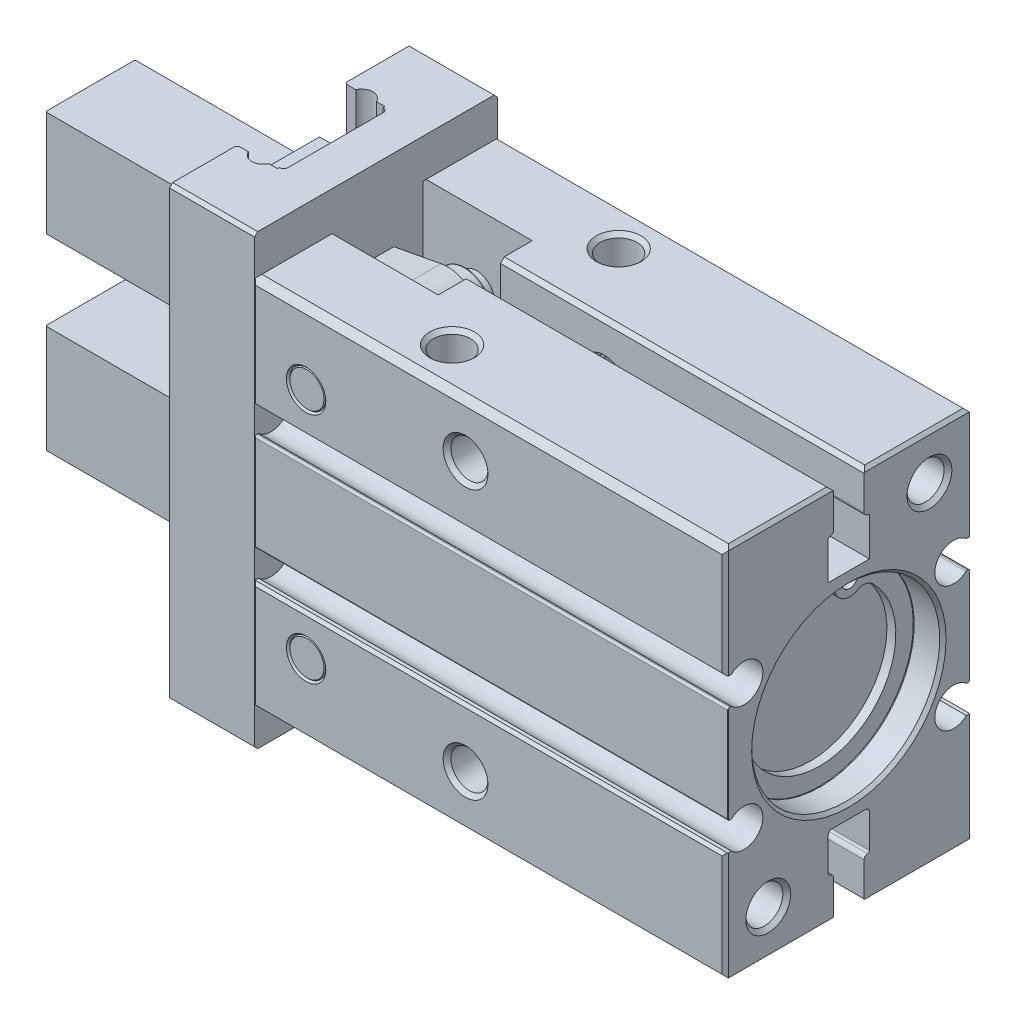
from build123d import *

# Parameters (mm, degrees)
EXTRUDE_1_DEPTH          = 52.8
CUT_EXTRUDE_1_DEPTH      = 21
CUT_EXTRUDE_1_DEPTH_BACK = 21
SKETCH_2_W               = 12.2
SKETCH_2_H               = 10.5
CUT_EXTRUDE_2_DEPTH      = 21
CUT_EXTRUDE_2_DEPTH_BACK = 21
SKETCH_5_W               = 54.8
SKETCH_5_H               = 29.6
CUT_EXTRUDE_3_DEPTH      = 13.8
CUT_EXTRUDE_3_DEPTH_BACK = 13.8
SKETCH_6_W               = 54.8
SKETCH_6_H               = 44
EXTRUDE_2_DEPTH          = 9.5
CUT_EXTRUDE_4_DEPTH      = 25
CUT_EXTRUDE_4_DEPTH_BACK = 25
EXTRUDE_3_DEPTH          = 19.4
EXTRUDE_4_DEPTH          = 19.4
EXTRUDE_5_DEPTH          = 8.399908734
EXTRUDE_5_DEPTH_BACK     = 3.365801971
EXTRUDE_6_DEPTH          = 12
EXTRUDE_6_DEPTH_BACK     = 0.0001
CUT_EXTRUDE_5_DEPTH      = 2.1
CUT_EXTRUDE_5_DEPTH_BACK = 2.1
SKETCH_20_W              = 7
SKETCH_20_H              = 9
EXTRUDE_7_DEPTH          = 2
EXTRUDE_7_DEPTH_BACK     = 2
SKETCH_26_R              = 1.65
SKETCH_26_R_2            = 1.5
CUT_EXTRUDE_6_DEPTH      = 0.2
CUT_EXTRUDE_7_DEPTH      = 0.5
SKETCH_28_R              = 1.65
SKETCH_28_R_2            = 1.5
EXTRUDE_8_DEPTH          = 0.2
CUT_EXTRUDE_8_DEPTH      = 0.5
CUT_EXTRUDE_START        = -0.2
SKETCH_30_R              = 1.65
SKETCH_30_R_2            = 1.5
CUT_EXTRUDE_9_DEPTH      = 0.2
CUT_EXTRUDE_10_DEPTH     = 0.5
SKETCH_32_R              = 1.65
SKETCH_32_R_2            = 1.5
CUT_EXTRUDE_11_DEPTH     = 0.2
CUT_EXTRUDE_12_DEPTH     = 0.5
EXTRUDE_START            = 1
SKETCH_39_R              = 0.9
EXTRUDE_9_DEPTH          = 1


with BuildPart() as part:
    # 草图1 → 凸台-拉伸1 (new body)
    with BuildSketch(Plane(origin=(0, 0, 0), x_dir=(0, 0, -1), z_dir=(1, 0, 0))):
        with BuildLine():
            Line((-13.8, 20.292893219), (-13.8, 8.85))
            Line((-13.8, 8.85), (-13.5, 8.55))
            Line((-13.5, 8.55), (-13.116862732, 8.55))
            ThreePointArc((-13.116862732, 8.55), (-9.600310792, 7.036127953), (-13.062700186, 5.402173913))
            ThreePointArc((-13.062700186, 5.402173913), (-13.123324748, 5.437662973), (-13.192481156, 5.45))
            Line((-13.192481156, 5.45), (-13.3, 5.45))
            ThreePointArc((-13.3, 5.45), (-13.441421356, 5.391421356), (-13.5, 5.25))
            Line((-13.5, 5.25), (-13.5, -5.25))
            ThreePointArc((-13.5, -5.25), (-13.441421356, -5.391421356), (-13.3, -5.45))
            Line((-13.3, -5.45), (-13.192481156, -5.45))
            ThreePointArc((-13.192481156, -5.45), (-13.123324748, -5.437662973), (-13.062700186, -5.402173913))
            ThreePointArc((-13.062700186, -5.402173913), (-9.600310792, -7.036127953), (-13.116862732, -8.55))
            Line((-13.116862732, -8.55), (-13.5, -8.55))
            Line((-13.5, -8.55), (-13.8, -8.85))
            Line((-13.8, -8.85), (-13.8, -20.292893219))
            Line((-13.8, -20.292893219), (-13.092893219, -21))
            Line((-13.092893219, -21), (-2.124264069, -21))
            Line((-2.124264069, -21), (-1.7, -20.575735931))
            Line((-1.7, -20.575735931), (-1.7, -16.8))
            ThreePointArc((-1.7, -16.8), (-1.817157296, -16.517157279), (-2.100000024, -16.4))
            ThreePointArc((-2.100000024, -16.4), (-2.241421365, -16.341421348), (-2.3, -16.2))
            Line((-2.3, -16.2), (-2.3, -12.4))
            ThreePointArc((-2.3, -12.4), (-2.182842712, -12.117157288), (-1.9, -12))
            Line((-1.9, -12), (1.9, -12))
            ThreePointArc((1.9, -12), (2.182842712, -12.117157288), (2.3, -12.4))
            Line((2.3, -12.4), (2.3, -16.2))
            ThreePointArc((2.3, -16.2), (2.241421348, -16.341421365), (2.099999976, -16.4))
            ThreePointArc((2.099999976, -16.4), (1.817157279, -16.517157296), (1.7, -16.8))
            Line((1.7, -16.8), (1.7, -20.575735931))
            Line((1.7, -20.575735931), (2.124264069, -21))
            Line((2.124264069, -21), (13.092893219, -21))
            Line((13.092893219, -21), (13.8, -20.292893219))
            Line((13.8, -20.292893219), (13.8, -8.85))
            Line((13.8, -8.85), (13.5, -8.55))
            Line((13.5, -8.55), (13.116862732, -8.55))
            ThreePointArc((13.116862732, -8.55), (9.600310792, -7.036127953), (13.062700186, -5.402173913))
            ThreePointArc((13.062700186, -5.402173913), (13.123324748, -5.437662973), (13.192481156, -5.45))
            Line((13.192481156, -5.45), (13.3, -5.45))
            ThreePointArc((13.3, -5.45), (13.441421356, -5.391421356), (13.5, -5.25))
            Line((13.5, -5.25), (13.5, 5.25))
            ThreePointArc((13.5, 5.25), (13.441421356, 5.391421356), (13.3, 5.45))
            Line((13.3, 5.45), (13.192481156, 5.45))
            ThreePointArc((13.192481156, 5.45), (13.123324748, 5.437662973), (13.062700186, 5.402173913))
            ThreePointArc((13.062700186, 5.402173913), (9.600310792, 7.036127953), (13.116862732, 8.55))
            Line((13.116862732, 8.55), (13.5, 8.55))
            Line((13.5, 8.55), (13.8, 8.85))
            Line((13.8, 8.85), (13.8, 20.292893219))
            Line((13.8, 20.292893219), (13.092893219, 21))
            Line((13.092893219, 21), (2.124264069, 21))
            Line((2.124264069, 21), (1.7, 20.575735931))
            Line((1.7, 20.575735931), (1.7, 16.8))
            ThreePointArc((1.7, 16.8), (1.817157279, 16.517157296), (2.099999976, 16.4))
            ThreePointArc((2.099999976, 16.4), (2.241421348, 16.341421365), (2.3, 16.2))
            Line((2.3, 16.2), (2.3, 12))
            Line((2.3, 12), (-2.3, 12))
            Line((-2.3, 12), (-2.3, 16.2))
            ThreePointArc((-2.3, 16.2), (-2.241421348, 16.341421365), (-2.099999976, 16.4))
            ThreePointArc((-2.099999976, 16.4), (-1.817157279, 16.517157296), (-1.7, 16.8))
            Line((-1.7, 16.8), (-1.7, 20.575735931))
            Line((-1.7, 20.575735931), (-2.124264069, 21))
            Line((-2.124264069, 21), (-13.092893219, 21))
            Line((-13.092893219, 21), (-13.8, 20.292893219))
        make_face()
    extrude(amount=-EXTRUDE_1_DEPTH)

    # 草图2 → 切除-拉伸1 (cut, two sides: drawn at the far end of the back side and taken through both)
    with BuildSketch(Plane(origin=(0, 0, 0), x_dir=(1, 0, 0), z_dir=(0, 1, 0)).offset(-CUT_EXTRUDE_1_DEPTH_BACK)):
        with Locations((-46.7, 0)):
            Rectangle(SKETCH_2_W, SKETCH_2_H)
    extrude(amount=CUT_EXTRUDE_1_DEPTH + CUT_EXTRUDE_1_DEPTH_BACK, mode=Mode.SUBTRACT)

    # 草图3 → 切除-旋转1 (revolve, cut)
    with BuildSketch(Plane(origin=(-29, 0, 0), x_dir=(0, 0, -1), z_dir=(1, 0, 0))):
        Polygon((-13.8, 15), (-13.8, 17.5), (-13.367, 17.067), (-3.8, 17.067), (-3.8, 17.51), (3.8, 17.51), (3.8, 17.067), (13.367, 17.067), (13.8, 17.5), (13.8, 15), align=None)
    revolve(axis=Axis((-29, 15, -13.8), (0, 0, 1)), mode=Mode.SUBTRACT)

    # 草图4 → 切除-旋转2 (revolve, cut)
    with BuildSketch(Plane(origin=(-29, 0, 0), x_dir=(0, 0, -1), z_dir=(1, 0, 0))):
        Polygon((-13.8, -15), (-13.8, -12.5), (-13.367, -12.933), (-3.8, -12.933), (-3.8, -12.49), (3.8, -12.49), (3.8, -12.933), (13.367, -12.933), (13.8, -12.5), (13.8, -15), align=None)
    revolve(axis=Axis((-29, -15, -13.8), (0, 0, 1)), mode=Mode.SUBTRACT)

    # 草图5 → 切除-拉伸2 (cut, two sides: drawn at the far end of the back side and taken through both)
    with BuildSketch(Plane(origin=(0, 0, 0), x_dir=(1, 0, 0), z_dir=(0, 1, 0)).offset(-CUT_EXTRUDE_2_DEPTH_BACK)):
        with Locations((-26.4, 0)):
            Rectangle(SKETCH_5_W, SKETCH_5_H)
        Polygon((-52.8, 13.446446609), (-52.8, -13.446446609), (-52.446446609, -13.8), (-0.353553391, -13.8), (0, -13.446446609), (0, 13.446446609), (-0.353553391, 13.8), (-52.446446609, 13.8), align=None, mode=Mode.SUBTRACT)
    extrude(amount=CUT_EXTRUDE_2_DEPTH + CUT_EXTRUDE_2_DEPTH_BACK, mode=Mode.SUBTRACT)

    # 草图6 → 切除-拉伸3 (cut, two sides: drawn at the far end of the back side and taken through both)
    with BuildSketch(Plane.XY.offset(-CUT_EXTRUDE_3_DEPTH_BACK)):
        with Locations((-26.4, 0)):
            Rectangle(SKETCH_6_W, SKETCH_6_H)
        Polygon((-52.8, -20.646446609), (-52.446446609, -21), (-0.353553391, -21), (0, -20.646446609), (0, 20.646446609), (-0.353553391, 21), (-52.446446609, 21), (-52.8, 20.646446609), align=None, mode=Mode.SUBTRACT)
    extrude(amount=CUT_EXTRUDE_3_DEPTH + CUT_EXTRUDE_3_DEPTH_BACK, mode=Mode.SUBTRACT)

    # 草图7 → 凸台-拉伸2 (add)
    with BuildSketch(Plane(origin=(-52.8, 0, 0), x_dir=(0, 0, -1), z_dir=(1, 0, 0))):
        Polygon((-13.55, -24.646446609), (-13.196446609, -25), (13.196446609, -25), (13.55, -24.646446609), (13.55, 24.646446609), (13.196446609, 25), (-13.196446609, 25), (-13.55, 24.646446609), align=None)
    extrude(amount=-EXTRUDE_2_DEPTH)

    # 草图8 → 切除-拉伸4 (cut, two sides: drawn at the far end of the back side and taken through both)
    with BuildSketch(Plane(origin=(0, 0, 0), x_dir=(1, 0, 0), z_dir=(0, 1, 0)).offset(-CUT_EXTRUDE_4_DEPTH_BACK)):
        with BuildLine():
            Line((-62.3, -6.212132034), (-62.087867966, -6))
            Line((-62.087867966, -6), (-61.045643924, -6))
            ThreePointArc((-61.045643924, -6), (-59.9, -6.75), (-58.754356076, -6))
            Line((-58.754356076, -6), (-57.8, -6))
            Line((-57.8, -6), (-57.8, -5.8))
            ThreePointArc((-57.8, -5.8), (-57.446446609, -5.653553391), (-57.3, -5.3))
            Line((-57.3, -5.3), (-57.3, 5.3))
            ThreePointArc((-57.3, 5.3), (-57.446446609, 5.653553391), (-57.8, 5.8))
            Line((-57.8, 5.8), (-57.8, 6))
            Line((-57.8, 6), (-58.754356076, 6))
            ThreePointArc((-58.754356076, 6), (-59.9, 6.75), (-61.045643924, 6))
            Line((-61.045643924, 6), (-62.087867966, 6))
            Line((-62.087867966, 6), (-62.3, 6.212132034))
            Line((-62.3, 6.212132034), (-62.3, -6.212132034))
        make_face()
    extrude(amount=CUT_EXTRUDE_4_DEPTH + CUT_EXTRUDE_4_DEPTH_BACK, mode=Mode.SUBTRACT)

    # 草图9 → 凸台-拉伸3 (add)
    with BuildSketch(Plane(origin=(0, 0.01, 0), x_dir=(1, 0, 0), z_dir=(0, 1, 0))):
        with BuildLine():
            Line((-64.1, -5), (-61.81, -5))
            Line((-61.81, -5), (-61.113631045, -6.200667934))
            ThreePointArc((-61.113631045, -6.200667934), (-59.9, -7.75), (-58.686368955, -6.200667934))
            Line((-58.686368955, -6.200667934), (-57.99, -5))
            Line((-57.99, -5), (-57.641421356, -5))
            Line((-57.641421356, -5), (-57.5, -4.858578644))
            Line((-57.5, -4.858578644), (-57.5, 4.858578644))
            Line((-57.5, 4.858578644), (-57.641421356, 5))
            Line((-57.641421356, 5), (-57.99, 5))
            Line((-57.99, 5), (-58.686368955, 6.200667934))
            ThreePointArc((-58.686368955, 6.200667934), (-59.9, 7.75), (-61.113631045, 6.200667934))
            Line((-61.113631045, 6.200667934), (-61.81, 5))
            Line((-61.81, 5), (-64.1, 5))
            Line((-64.1, 5), (-64.1, -5))
        make_face()
    extrude(amount=EXTRUDE_3_DEPTH)

    # 草图10 → 凸台-拉伸4 (add)
    with BuildSketch(Plane(origin=(0, -0.01, 0), x_dir=(1, 0, 0), z_dir=(0, 1, 0))):
        with BuildLine():
            Line((-64.1, -5), (-61.81, -5))
            Line((-61.81, -5), (-61.113631045, -6.200667934))
            ThreePointArc((-61.113631045, -6.200667934), (-59.9, -7.75), (-58.686368955, -6.200667934))
            Line((-58.686368955, -6.200667934), (-57.99, -5))
            Line((-57.99, -5), (-57.641421356, -5))
            Line((-57.641421356, -5), (-57.5, -4.858578644))
            Line((-57.5, -4.858578644), (-57.5, 4.858578644))
            Line((-57.5, 4.858578644), (-57.641421356, 5))
            Line((-57.641421356, 5), (-57.99, 5))
            Line((-57.99, 5), (-58.686368955, 6.200667934))
            ThreePointArc((-58.686368955, 6.200667934), (-59.9, 7.75), (-61.113631045, 6.200667934))
            Line((-61.113631045, 6.200667934), (-61.81, 5))
            Line((-61.81, 5), (-64.1, 5))
            Line((-64.1, 5), (-64.1, -5))
        make_face()
    extrude(amount=-EXTRUDE_4_DEPTH)

    # 草图11 → 凸台-拉伸5 (add, two sides: drawn at the far end of the back side and taken through both)
    with BuildSketch(Plane(origin=(0, 8.15, 0), x_dir=(1, 0, 0), z_dir=(0, 1, 0)).offset(-EXTRUDE_5_DEPTH_BACK)):
        Polygon((-84.7, -4.858578644), (-84.558578644, -5), (-64.1, -5), (-64.1, 5), (-84.558578644, 5), (-84.7, 4.858578644), align=None)
    extrude(amount=EXTRUDE_5_DEPTH + EXTRUDE_5_DEPTH_BACK)

    # 草图12 → 凸台-拉伸6 (add, two sides: drawn at the far end of the back side and taken through both)
    with BuildSketch(Plane(origin=(0, -16.16, 0), x_dir=(1, 0, 0), z_dir=(0, 1, 0)).offset(-EXTRUDE_6_DEPTH_BACK)):
        Polygon((-84.7, -4.858578644), (-84.558578644, -5), (-64.1, -5), (-64.1, 5), (-84.558578644, 5), (-84.7, 4.858578644), align=None)
    extrude(amount=EXTRUDE_6_DEPTH + EXTRUDE_6_DEPTH_BACK)

    # 草图13 → 旋转1 (revolve)
    with BuildSketch(Plane(origin=(-46.8, 0, 0), x_dir=(0, 0, -1), z_dir=(1, 0, 0))):
        with BuildLine():
            Line((-13.8, 13), (-13.8, 15))
            Line((-13.8, 15), (-4, 15))
            Line((-4, 15), (-4, 15.8))
            ThreePointArc((-4, 15.8), (-3.941421356, 15.941421356), (-3.8, 16))
            Line((-3.8, 16), (-2, 16))
            Line((-2, 16), (-2, 16.3))
            ThreePointArc((-2, 16.3), (-1.941421356, 16.441421356), (-1.8, 16.5))
            Line((-1.8, 16.5), (1.8, 16.5))
            ThreePointArc((1.8, 16.5), (1.941421356, 16.441421356), (2, 16.3))
            Line((2, 16.3), (2, 16))
            Line((2, 16), (3.8, 16))
            ThreePointArc((3.8, 16), (3.941421356, 15.941421356), (4, 15.8))
            Line((4, 15.8), (4, 15))
            Line((4, 15), (13.8, 15))
            Line((13.8, 15), (13.8, 13))
            Line((13.8, 13), (-13.8, 13))
        make_face()
    revolve(axis=Axis((-46.8, 13, -13.8), (0, 0, 1)))

    # 草图14 → 旋转2 (revolve)
    with BuildSketch(Plane(origin=(-46.8, 0, 0), x_dir=(0, 0, -1), z_dir=(1, 0, 0))):
        with BuildLine():
            Line((-13.8, -13), (-13.8, -11))
            Line((-13.8, -11), (-4, -11))
            Line((-4, -11), (-4, -10.2))
            ThreePointArc((-4, -10.2), (-3.941421356, -10.058578644), (-3.8, -10))
            Line((-3.8, -10), (-2, -10))
            Line((-2, -10), (-2, -9.7))
            ThreePointArc((-2, -9.7), (-1.941421356, -9.558578644), (-1.8, -9.5))
            Line((-1.8, -9.5), (1.8, -9.5))
            ThreePointArc((1.8, -9.5), (1.941421356, -9.558578644), (2, -9.7))
            Line((2, -9.7), (2, -10))
            Line((2, -10), (3.8, -10))
            ThreePointArc((3.8, -10), (3.941421356, -10.058578644), (4, -10.2))
            Line((4, -10.2), (4, -11))
            Line((4, -11), (13.8, -11))
            Line((13.8, -11), (13.8, -13))
            Line((13.8, -13), (-13.8, -13))
        make_face()
    revolve(axis=Axis((-46.8, -13, -13.8), (0, 0, 1)))

    # 草图15 → 切除-旋转3 (revolve, cut)
    with BuildSketch(Plane(origin=(-46.8, 0, 0), x_dir=(0, 0, -1), z_dir=(1, 0, 0))):
        Polygon((13.7, 13), (13.7, 14.9), (13.6, 15), (13.8, 15.2), (13.8, 13), align=None)
    revolve(axis=Axis((-46.8, 13, -13.8), (0, 0, 1)), mode=Mode.SUBTRACT)

    # 草图16 → 切除-旋转4 (revolve, cut)
    with BuildSketch(Plane(origin=(-46.8, 0, 0), x_dir=(0, 0, -1), z_dir=(1, 0, 0))):
        Polygon((-13.8, 13), (-13.8, 15.2), (-13.6, 15), (-13.7, 14.9), (-13.7, 13), align=None)
    revolve(axis=Axis((-46.8, 13, 13.7), (0, 0, 1)), mode=Mode.SUBTRACT)

    # 草图17 → 切除-旋转5 (revolve, cut)
    with BuildSketch(Plane(origin=(-46.8, 0, 0), x_dir=(0, 0, -1), z_dir=(1, 0, 0))):
        Polygon((13.7, -13), (13.7, -11.1), (13.6, -11), (13.8, -10.8), (13.8, -13), align=None)
    revolve(axis=Axis((-46.8, -13, -13.8), (0, 0, 1)), mode=Mode.SUBTRACT)

    # 草图18 → 切除-旋转6 (revolve, cut)
    with BuildSketch(Plane(origin=(-46.8, 0, 0), x_dir=(0, 0, -1), z_dir=(1, 0, 0))):
        Polygon((-13.8, -13), (-13.8, -10.8), (-13.6, -11), (-13.7, -11.1), (-13.7, -13), align=None)
    revolve(axis=Axis((-46.8, -13, 13.7), (0, 0, 1)), mode=Mode.SUBTRACT)

    # 草图19 → 旋转3 (revolve)
    with BuildSketch(Plane.XY):
        Polygon((-49.6, 0), (-49.6, 3.646446609), (-49.246446609, 4), (-41.7, 4), (-40.7, 5), (-40.59, 5), (-40.59, 0), align=None)
    revolve(axis=Axis((-40.59, 0, 0), (-1, 0, 0)))

    # 草图20 → 切除-拉伸5 (cut, two sides: drawn at the far end of the back side and taken through both)
    with BuildSketch(Plane.XY.offset(-CUT_EXTRUDE_5_DEPTH_BACK)):
        with Locations((-46.8, 0)):
            Rectangle(SKETCH_20_W, SKETCH_20_H)
    extrude(amount=CUT_EXTRUDE_5_DEPTH + CUT_EXTRUDE_5_DEPTH_BACK, mode=Mode.SUBTRACT)

    # 草图21 → 凸台-拉伸7 (add, two sides: drawn at the far end of the back side and taken through both)
    with BuildSketch(Plane.XY.offset(-EXTRUDE_7_DEPTH_BACK)):
        with BuildLine():
            Line((-60.908323946, -12.646170314), (-60.887381058, -13.845987548))
            ThreePointArc((-60.887381058, -13.845987548), (-60.582191733, -14.547874942), (-59.870080956, -14.828382837))
            Line((-59.870080956, -14.828382837), (-58.850236307, -14.810581382))
            Line((-58.850236307, -14.810581382), (-47.537054923, -16.93150735))
            ThreePointArc((-47.537054923, -16.93150735), (-43.967181378, -15.824028799), (-42.870802157, -12.250730817))
            Line((-42.870802157, -12.250730817), (-43.3, -10))
            Line((-43.3, -10), (-43.3, 10))
            Line((-43.3, 10), (-42.870802157, 12.250730817))
            ThreePointArc((-42.870802157, 12.250730817), (-43.967181378, 15.824028799), (-47.537054923, 16.93150735))
            Line((-47.537054923, 16.93150735), (-58.850236307, 14.810581382))
            Line((-58.850236307, 14.810581382), (-59.870080956, 14.828382837))
            ThreePointArc((-59.870080956, 14.828382837), (-60.582191733, 14.547874942), (-60.887381058, 13.845987548))
            Line((-60.887381058, 13.845987548), (-60.908323946, 12.646170314))
            ThreePointArc((-60.908323946, 12.646170314), (-60.627816051, 11.934059537), (-59.925928657, 11.628870212))
            Line((-59.925928657, 11.628870212), (-58.906084008, 11.611068758))
            Line((-58.906084008, 11.611068758), (-51.863093222, 10.034423442))
            ThreePointArc((-51.863093222, 10.034423442), (-50.738940495, 9.33296594), (-50.3, 8.082728674))
            Line((-50.3, 8.082728674), (-50.3, -8.082728674))
            ThreePointArc((-50.3, -8.082728674), (-50.738940495, -9.33296594), (-51.863093222, -10.034423442))
            Line((-51.863093222, -10.034423442), (-58.906084008, -11.611068758))
            Line((-58.906084008, -11.611068758), (-59.925928657, -11.628870212))
            ThreePointArc((-59.925928657, -11.628870212), (-60.627816051, -11.934059537), (-60.908323946, -12.646170314))
        make_face()
    extrude(amount=EXTRUDE_7_DEPTH + EXTRUDE_7_DEPTH_BACK)

    # 草图22 → 切除-旋转7 (revolve, cut)
    with BuildSketch(Plane.XY):
        Polygon((-79.7, 8.15), (-81.7, 8.15), (-81.321, 8.529), (-81.321, 15.781), (-81.7, 16.16), (-79.7, 16.16), align=None)
    revolve(axis=Axis((-79.7, 16.16, 0), (0, -1, 0)), mode=Mode.SUBTRACT)

    # 草图23 → 切除-旋转8 (revolve, cut)
    with BuildSketch(Plane.XY):
        Polygon((-79.7, -16.16), (-81.7, -16.16), (-81.321, -15.781), (-81.321, -8.529), (-81.7, -8.15), (-79.7, -8.15), align=None)
    revolve(axis=Axis((-79.7, -8.15, 0), (0, -1, 0)), mode=Mode.SUBTRACT)

    # 草图24 → 切除-旋转9 (revolve, cut)
    with BuildSketch(Plane.XY):
        Polygon((-70.7, 8.15), (-72.7, 8.15), (-72.321, 8.529), (-72.321, 15.781), (-72.7, 16.16), (-70.7, 16.16), align=None)
    revolve(axis=Axis((-70.7, 16.16, 0), (0, -1, 0)), mode=Mode.SUBTRACT)

    # 草图25 → 切除-旋转10 (revolve, cut)
    with BuildSketch(Plane.XY):
        Polygon((-70.7, -16.16), (-72.7, -16.16), (-72.321, -15.781), (-72.321, -8.529), (-72.7, -8.15), (-70.7, -8.15), align=None)
    revolve(axis=Axis((-70.7, -8.15, 0), (0, -1, 0)), mode=Mode.SUBTRACT)

    # 草图26 → 切除-拉伸6 (cut)
    with BuildSketch(Plane(origin=(0, -19.41, 0), x_dir=(1, 0, 0), z_dir=(0, 1, 0))):
        with Locations((-61, -2.25)):
            Circle(SKETCH_26_R)
        with Locations((-61, -2.25)):
            Circle(SKETCH_26_R_2, mode=Mode.SUBTRACT)
    extrude(amount=CUT_EXTRUDE_6_DEPTH, mode=Mode.SUBTRACT)

    # 草图27 → 切除-拉伸7 (cut)
    with BuildSketch(Plane(origin=(0, -19.41, 0), x_dir=(1, 0, 0), z_dir=(0, 1, 0))):
        Polygon((-62, -2.5), (-61.25, -2.5), (-61.25, -3.25), (-60.75, -3.25), (-60.75, -2.5), (-60, -2.5), (-60, -2), (-60.75, -2), (-60.75, -1.25), (-61.25, -1.25), (-61.25, -2), (-62, -2), align=None)
    extrude(amount=CUT_EXTRUDE_7_DEPTH, mode=Mode.SUBTRACT)

    # 草图28 → 凸台-拉伸8 (add)
    with BuildSketch(Plane(origin=(0, -19.41, 0), x_dir=(1, 0, 0), z_dir=(0, 1, 0))):
        with Locations((-61, 2.25)):
            Circle(SKETCH_28_R)
        with Locations((-61, 2.25)):
            Circle(SKETCH_28_R_2, mode=Mode.SUBTRACT)
    extrude(amount=-EXTRUDE_8_DEPTH)

    # 草图29 → 切除-拉伸8 (cut)
    with BuildSketch(Plane(origin=(0, -19.41, 0), x_dir=(1, 0, 0), z_dir=(0, 1, 0))):
        Polygon((-62, 2), (-61.25, 2), (-61.25, 1.25), (-60.75, 1.25), (-60.75, 2), (-60, 2), (-60, 2.5), (-60.75, 2.5), (-60.75, 3.25), (-61.25, 3.25), (-61.25, 2.5), (-62, 2.5), align=None)
    extrude(amount=CUT_EXTRUDE_8_DEPTH, mode=Mode.SUBTRACT)

    # 草图30 → 切除-拉伸9 (cut)
    with BuildSketch(Plane(origin=(0, 19.41, 0), x_dir=(1, 0, 0), z_dir=(0, 1, 0)).offset(CUT_EXTRUDE_START)):
        with Locations((-61, -2.25)):
            Circle(SKETCH_30_R)
        with Locations((-61, -2.25)):
            Circle(SKETCH_30_R_2, mode=Mode.SUBTRACT)
    extrude(amount=CUT_EXTRUDE_9_DEPTH, mode=Mode.SUBTRACT)

    # 草图31 → 切除-拉伸10 (cut)
    with BuildSketch(Plane(origin=(0, 19.41, 0), x_dir=(1, 0, 0), z_dir=(0, 1, 0))):
        Polygon((-62, -2.5), (-61.25, -2.5), (-61.25, -3.25), (-60.75, -3.25), (-60.75, -2.5), (-60, -2.5), (-60, -2), (-60.75, -2), (-60.75, -1.25), (-61.25, -1.25), (-61.25, -2), (-62, -2), align=None)
    extrude(amount=-CUT_EXTRUDE_10_DEPTH, mode=Mode.SUBTRACT)

    # 草图32 → 切除-拉伸11 (cut)
    with BuildSketch(Plane(origin=(0, 19.41, 0), x_dir=(1, 0, 0), z_dir=(0, 1, 0))):
        with Locations((-61, 2.25)):
            Circle(SKETCH_32_R)
        with Locations((-61, 2.25)):
            Circle(SKETCH_32_R_2, mode=Mode.SUBTRACT)
    extrude(amount=-CUT_EXTRUDE_11_DEPTH, mode=Mode.SUBTRACT)

    # 草图33 → 切除-拉伸12 (cut)
    with BuildSketch(Plane(origin=(0, 19.41, 0), x_dir=(1, 0, 0), z_dir=(0, 1, 0))):
        Polygon((-62, 2), (-61.25, 2), (-61.25, 1.25), (-60.75, 1.25), (-60.75, 2), (-60, 2), (-60, 2.5), (-60.75, 2.5), (-60.75, 3.25), (-61.25, 3.25), (-61.25, 2.5), (-62, 2.5), align=None)
    extrude(amount=-CUT_EXTRUDE_12_DEPTH, mode=Mode.SUBTRACT)

    # 草图34 → 切除-旋转11 (revolve, cut)
    with BuildSketch(Plane.XY.offset(7.5)):
        Polygon((-23, -14), (-22.75, -14), (-22.75, -16), (-20.933, -16), (-20.933, -20.567), (-20.5, -21), (-23, -21), align=None)
    revolve(axis=Axis((-23, -21, 7.5), (0, 1, 0)), mode=Mode.SUBTRACT)

    # 草图35 → 切除-旋转12 (revolve, cut)
    with BuildSketch(Plane.XY.offset(-7.5)):
        Polygon((-9.7, -14), (-9.45, -14), (-9.45, -16), (-7.633, -16), (-7.633, -20.567), (-7.2, -21), (-9.7, -21), align=None)
    revolve(axis=Axis((-9.7, -21, -7.5), (0, 1, 0)), mode=Mode.SUBTRACT)

    # 草图36 → 切除-旋转13 (revolve, cut)
    with BuildSketch(Plane(origin=(-35, 0, 0), x_dir=(0, 0, -1), z_dir=(1, 0, 0))):
        Polygon((-9.3, 12), (-10.500974596, 12), (-11.367, 12.5), (-11.367, 20.567), (-11.8, 21), (-9.3, 21), align=None)
    revolve(axis=Axis((-35, 21, 9.3), (0, -1, 0)), mode=Mode.SUBTRACT)

    # 草图37 → 切除-旋转14 (revolve, cut)
    with BuildSketch(Plane(origin=(-35, 0, 0), x_dir=(0, 0, -1), z_dir=(1, 0, 0))):
        Polygon((9.3, 12), (8.099025404, 12), (7.233, 12.5), (7.233, 20.567), (6.8, 21), (9.3, 21), align=None)
    revolve(axis=Axis((-35, 21, -9.3), (0, -1, 0)), mode=Mode.SUBTRACT)

    # 草图38 → 切除-旋转15 (revolve, cut)
    with BuildSketch(Plane.XY):
        Polygon((-4.3, 0), (-4.3, 11), (-3.2, 11), (-3.2, 10.5), (-0.353553391, 10.5), (0, 10.853553391), (0, 0), align=None)
    revolve(axis=Axis((0, 0, 0), (-1, 0, 0)), mode=Mode.SUBTRACT)

    # 草图39 → 凸台-拉伸9 (add)
    with BuildSketch(Plane(origin=(-4.3, 0, 0), x_dir=(0, 0, -1), z_dir=(1, 0, 0)).offset(EXTRUDE_START)):
        with BuildLine():
            Line((1.983780074, 9.37201241), (1.735203345, 8.197656333))
            ThreePointArc((1.735203345, 8.197656333), (2.383504796, 6.481767864), (4.213303422, 6.353685881))
            ThreePointArc((4.213303422, 6.353685881), (5.137922641, 6.523126971), (5.981818993, 6.109037693))
            ThreePointArc((5.981818993, 6.109037693), (0.125927672, -8.549072594), (-6.159156749, 5.930201358))
            ThreePointArc((-6.159156749, 5.930201358), (-5.29343443, 6.374351167), (-4.337316388, 6.193845006))
            ThreePointArc((-4.337316388, 6.193845006), (-2.295503867, 6.298450124), (-1.530656764, 8.194485333))
            Line((-1.530656764, 8.194485333), (-1.758973161, 9.416794222))
            ThreePointArc((-1.758973161, 9.416794222), (-2.160351516, 10.003156187), (-2.864045882, 10.101843455))
            ThreePointArc((-2.864045882, 10.101843455), (-0.125622861, -10.499248492), (3.104927234, 10.030425059))
            ThreePointArc((3.104927234, 10.030425059), (2.399073084, 9.948602953), (1.983780074, 9.37201241))
        make_face()
        with Locations((3.398353309, 7.845616279)):
            Circle(SKETCH_39_R, mode=Mode.SUBTRACT)
        with Locations((-3.398353309, 7.845616279)):
            Circle(SKETCH_39_R, mode=Mode.SUBTRACT)
    extrude(amount=-EXTRUDE_9_DEPTH)

    # 草图40 → 切除-旋转16 (revolve, cut)
    with BuildSketch(Plane.XY.offset(9)):
        Polygon((-11, -16), (-11, -14.799025404), (-10.5, -13.933), (-0.433, -13.933), (0, -13.5), (0, -16), align=None)
    revolve(axis=Axis((0, -16, 9), (-1, 0, 0)), mode=Mode.SUBTRACT)

    # 草图41 → 切除-旋转17 (revolve, cut)
    with BuildSketch(Plane.XY.offset(-9)):
        Polygon((-11, 16), (-11, 17.200974596), (-10.5, 18.067), (-0.433, 18.067), (0, 18.5), (0, 16), align=None)
    revolve(axis=Axis((0, 16, -9), (-1, 0, 0)), mode=Mode.SUBTRACT)


solid = part.part
